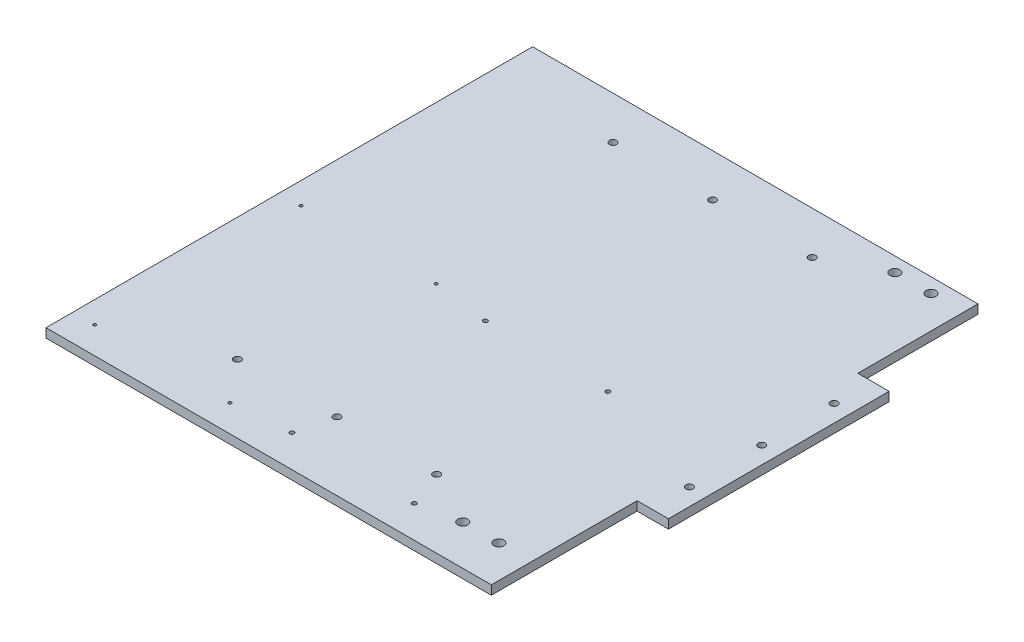
from build123d import *

# Parameters (mm, degrees)
SKETCH1_W           = 313
SKETCH1_H           = 342
BOSS_EXTRUDE1_DEPTH = 6.35
SKETCH3_W           = 22
SKETCH3_H           = 155.14040353
SKETCH3_R           = 2.5
BOSS_EXTRUDE2_DEPTH = 6.35
SKETCH2_R           = 2.5
CUT_EXTRUDE1_DEPTH  = 248.272263912
SKETCH4_R           = 3.5
CUT_EXTRUDE2_DEPTH  = 248.272263912
SKETCH5_R           = 1.5
SKETCH5_R_2         = 1.05
CUT_EXTRUDE3_DEPTH  = 248.272263912


with BuildPart() as part:
    # Sketch1 → Boss-Extrude1 (new body)
    with BuildSketch(Plane(origin=(0, 0, 0), x_dir=(1, 0, 0), z_dir=(0, 1, 0))):
        Rectangle(SKETCH1_W, SKETCH1_H)
    extrude(amount=-BOSS_EXTRUDE1_DEPTH)

    # Sketch3 → Boss-Extrude2 (add)
    with BuildSketch(Plane(origin=(0, 0, 0), x_dir=(1, 0, 0), z_dir=(0, 1, 0))):
        with Locations((167.5, 9)):
            Rectangle(SKETCH3_W, SKETCH3_H)
        with Locations((166.5, 9)):
            Circle(SKETCH3_R, mode=Mode.SUBTRACT)
        with Locations((166.5, -41.8)):
            Circle(SKETCH3_R, mode=Mode.SUBTRACT)
        with Locations((166.5, 59.8)):
            Circle(SKETCH3_R, mode=Mode.SUBTRACT)
    extrude(amount=-BOSS_EXTRUDE2_DEPTH)

    # Sketch2 → Cut-Extrude1 (cut, through all)
    with BuildSketch(Plane(origin=(0, 0, 0), x_dir=(1, 0, 0), z_dir=(0, 1, 0))):
        with Locations((0, -123)):
            Circle(SKETCH2_R)
        with Locations((-70, -123)):
            Circle(SKETCH2_R)
        with Locations((70, -123)):
            Circle(SKETCH2_R)
        with Locations((-70, 141)):
            Circle(SKETCH2_R)
        with Locations((0, 141)):
            Circle(SKETCH2_R)
        with Locations((70, 141)):
            Circle(SKETCH2_R)
    extrude(amount=-CUT_EXTRUDE1_DEPTH, mode=Mode.SUBTRACT)

    # Sketch4 → Cut-Extrude2 (cut, through all)
    with BuildSketch(Plane(origin=(0, 0, 0), x_dir=(1, 0, 0), z_dir=(0, 1, 0))):
        with Locations((133.64, -142.84)):
            Circle(SKETCH4_R)
        with Locations((108.24, -142.84)):
            Circle(SKETCH4_R)
    cut_extrude2 = extrude(amount=-CUT_EXTRUDE2_DEPTH, mode=Mode.SUBTRACT)

    # Mirror1: Cut-Extrude2 across plane
    add(cut_extrude2.mirror(Plane(origin=(0, 0, -9), x_dir=(1, 0, 0), z_dir=(0, 0, -1))), mode=Mode.SUBTRACT)

    # Sketch5 → Cut-Extrude3 (cut, through all)
    with BuildSketch(Plane(origin=(0, 0, 0), x_dir=(1, 0, 0), z_dir=(0, 1, 0))):
        with Locations((79.770037453, -148.470411985)):
            Circle(SKETCH5_R)
        with Locations((-6.229962547, -148.470411985)):
            Circle(SKETCH5_R)
        with Locations((-6.229962547, -12.470411985)):
            Circle(SKETCH5_R)
        with Locations((79.770037453, -12.470411985)):
            Circle(SKETCH5_R)
        with Locations((-46.113857678, -7.113857678)):
            Circle(SKETCH5_R_2)
        with Locations((-46.113857678, -152.113857678)):
            Circle(SKETCH5_R_2)
        with Locations((-141.113857678, -7.113857678)):
            Circle(SKETCH5_R_2)
        with Locations((-141.113857678, -152.113857678)):
            Circle(SKETCH5_R_2)
    extrude(amount=-CUT_EXTRUDE3_DEPTH, mode=Mode.SUBTRACT)


solid = part.part
